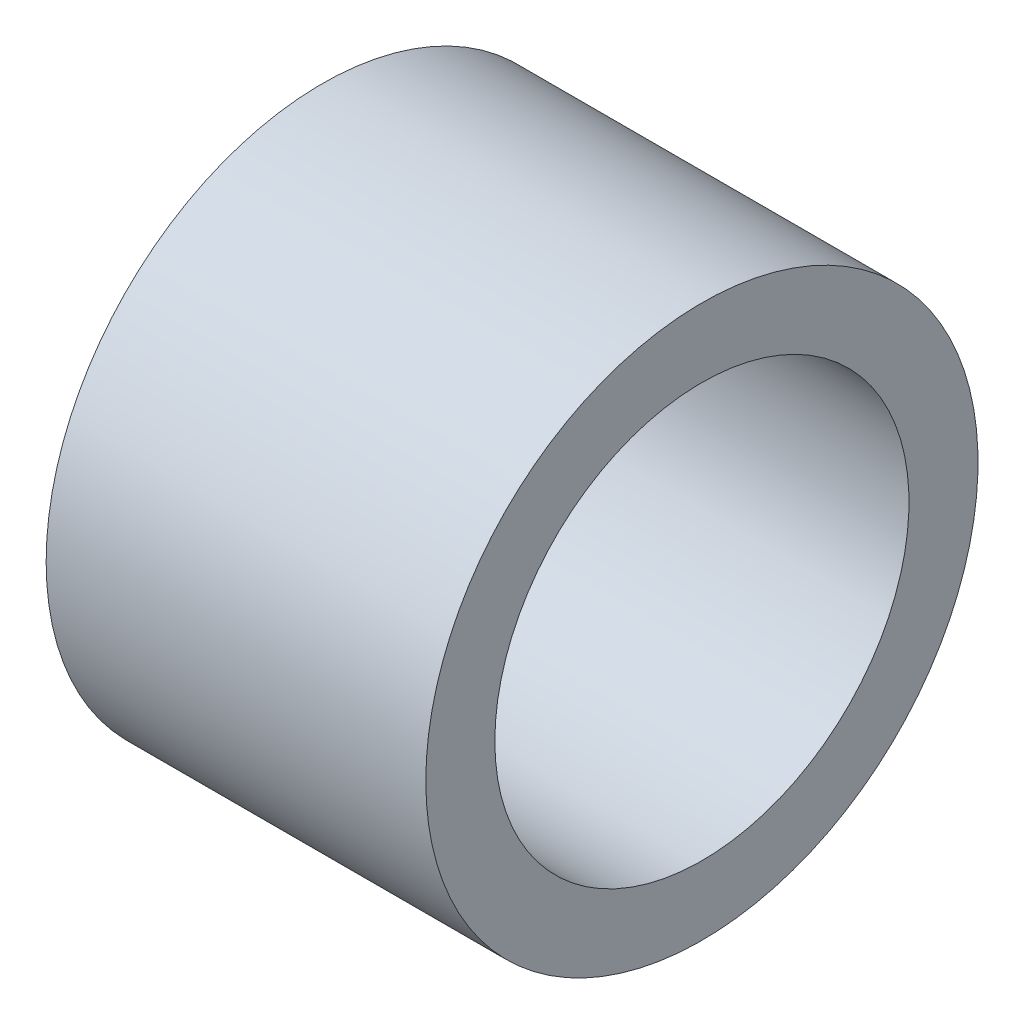
from build123d import *

# Parameters (mm, degrees)
SKETCH1_W = 5.5
SKETCH1_H = 1


with BuildPart() as part:
    # Sketch1 → Revolve1 (revolve)
    with BuildSketch(Plane.XY):
        with Locations((2.75, 3.5)):
            Rectangle(SKETCH1_W, SKETCH1_H)
    revolve(axis=Axis((0, 0, 0), (1, 0, 0)))


solid = part.part
